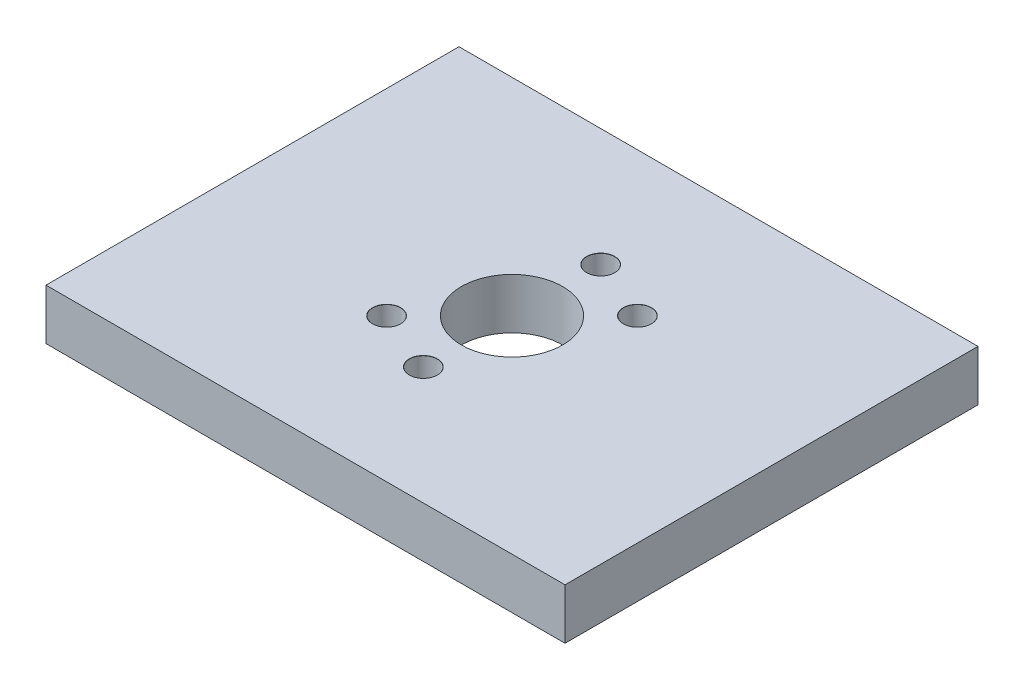
from build123d import *

# Parameters (mm, degrees)
SKETCH1_W                      = 102.443759186
SKETCH1_H                      = 81.508386056
BOSS_EXTRUDE1_DEPTH            = 10
M5_CLEARANCE_HOLE1_D           = 5.5
M5_CLEARANCE_HOLE1_CSINK_D     = 5.55
M5_CLEARANCE_HOLE1_CSINK_ANGLE = 90
SKETCH5_R                      = 10
CUT_EXTRUDE1_DEPTH             = 67.216200422


with BuildPart() as part:
    # Sketch1 → Boss-Extrude1 (new body)
    with BuildSketch(Plane(origin=(0, 0, 0), x_dir=(1, 0, 0), z_dir=(0, 1, 0))):
        Rectangle(SKETCH1_W, SKETCH1_H)
    extrude(amount=BOSS_EXTRUDE1_DEPTH)

    # M5 Clearance Hole1 (through all)
    with Locations(Plane(origin=(0, 10, 0), x_dir=(1, 0, 0), z_dir=(0, 1, 0))):
        with Locations((-12.374368671, -12.374368671), (0, -17.5), (12.374368671, 12.374368671), (0, 17.5)):
            CounterSinkHole(M5_CLEARANCE_HOLE1_D / 2, M5_CLEARANCE_HOLE1_CSINK_D / 2, counter_sink_angle=M5_CLEARANCE_HOLE1_CSINK_ANGLE)

    # Sketch5 → Cut-Extrude1 (cut, through all)
    with BuildSketch(Plane(origin=(0, 10, 0), x_dir=(1, 0, 0), z_dir=(0, 1, 0))):
        Circle(SKETCH5_R)
    extrude(amount=-CUT_EXTRUDE1_DEPTH, mode=Mode.SUBTRACT)


solid = part.part
